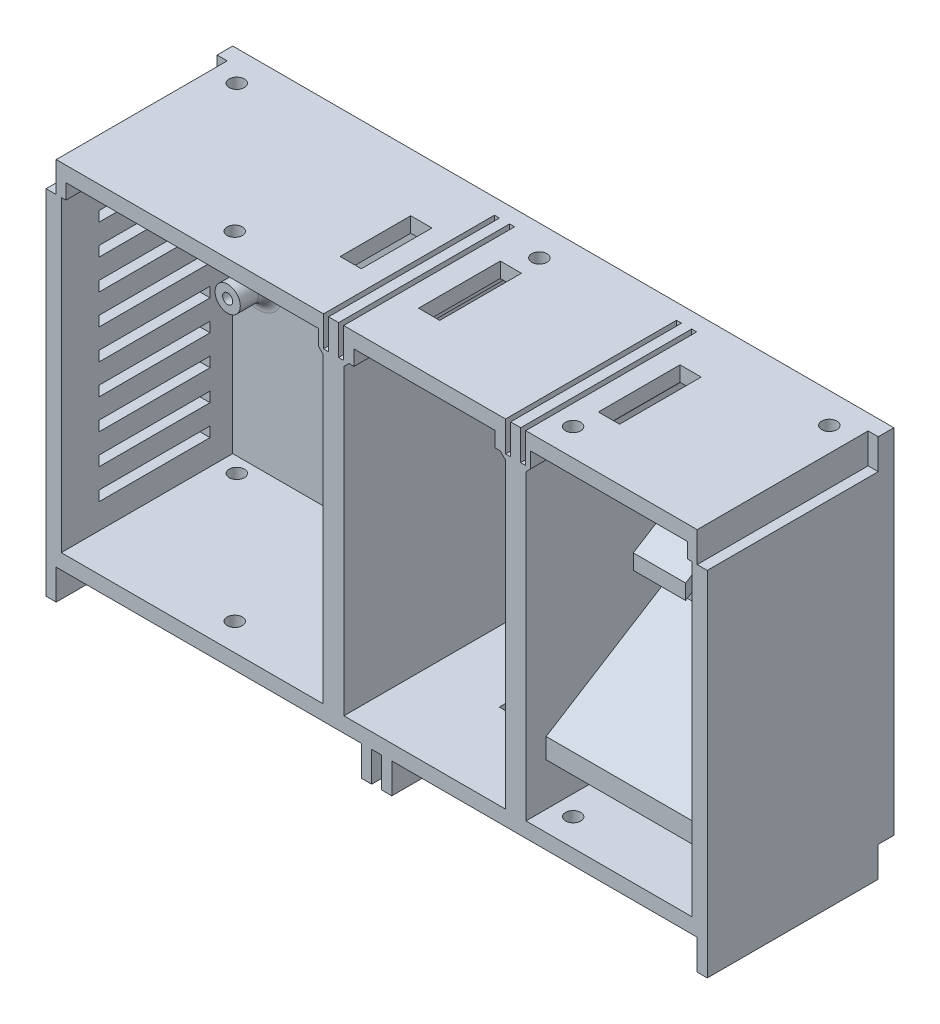
from build123d import *

# Parameters (mm, degrees)
CROQUIS1_W                = 32.1
CROQUIS1_H                = 6
SALIENTE_EXTRUIR1_DEPTH   = 34
CROQUIS1_W_2              = 53
SALIENTE_EXTRUIR1_2_DEPTH = 34
CROQUIS1_W_3              = 34
SALIENTE_EXTRUIR1_3_DEPTH = 34
CROQUIS1_W_4              = 2
SALIENTE_EXTRUIR1_4_DEPTH = 34
SALIENTE_EXTRUIR1_5_DEPTH = 34
SALIENTE_EXTRUIR2_DEPTH   = 3
SALIENTE_EXTRUIR3_DEPTH   = 31
SALIENTE_EXTRUIR4_DEPTH   = 3
SALIENTE_EXTRUIR10_DEPTH  = 31
CORTAR_EXTRUIR1_REACH     = 151.797
CROQUIS6_W                = 4.2
CROQUIS6_H                = 14
CROQUIS6_H_2              = 16.2
CORTAR_EXTRUIR2_START     = -31
CROQUIS7_W                = 25.05
CROQUIS7_H                = 3
CROQUIS7_W_2              = 14
CROQUIS7_W_3              = 15.6
CORTAR_EXTRUIR2_DEPTH     = 31
CORTAR_EXTRUIR8_DEPTH     = 3
CROQUIS24_W               = 4.416361802
CROQUIS24_H               = 6.54510403
CORTAR_EXTRUIR11_DEPTH    = 149.050025329
CROQUIS25_W               = 53
CROQUIS25_H               = 6
CROQUIS25_W_2             = 32.1
CROQUIS25_W_3             = 34
SALIENTE_EXTRUIR15_DEPTH  = 1
CROQUIS26_W               = 10
CROQUIS26_H               = 6
CROQUIS26_R               = 2.5
CROQUIS26_R_2             = 1
SALIENTE_EXTRUIR16_DEPTH  = 6
REDONDEO1_R               = 2.4
CHAFL_N1_SIZE             = 1
CROQUIS10_W               = 22
CROQUIS10_H               = 2
CORTAR_EXTRUIR3_DEPTH     = 3
SALIENTE_EXTRUIR12_DEPTH  = 32.95
SALIENTE_EXTRUIR17_DEPTH  = 32.95
CROQUIS38_W               = 6.1
CROQUIS38_H               = 26
CORTAR_EXTRUIR12_DEPTH    = 16.339354
CORTAR_EXTRUIR13_REACH    = 153.103
CROQUIS40_R               = 1.5
CROQUIS42_W               = 31.075
CROQUIS42_H               = 1
CROQUIS42_W_2             = 30
CROQUIS42_W_3             = 50.896493166
CROQUIS42_H_2             = 1.1
SALIENTE_EXTRUIR18_DEPTH  = 0.2
CROQUIS44_R               = 2.5
CROQUIS44_R_2             = 1.2
SALIENTE_EXTRUIR19_DEPTH  = 3
REDONDEO2_R               = 3
CROQUIS48_W               = 3.1
CROQUIS48_H               = 6
SALIENTE_EXTRUIR20_DEPTH  = 131.1
CROQUIS49_W               = 2
CROQUIS49_H               = 6
SALIENTE_EXTRUIR21_DEPTH  = 33.9
CROQUIS50_R               = 1.5
CORTAR_EXTRUIR14_DEPTH    = 3
CROQUIS51_W               = 0.1
CROQUIS51_H               = 70
CORTAR_EXTRUIR15_DEPTH    = 153.457239907
CROQUIS52_W               = 6
CROQUIS52_H               = 8
CORTAR_EXTRUIR16_DEPTH    = 3
CROQUIS53_W               = 32.95
CROQUIS53_H               = 4
CROQUIS53_H_2             = 2.672226941
CORTAR_EXTRUIR17_DEPTH    = 4
CROQUIS54_W               = 131.1
CROQUIS54_H               = 70
SALIENTE_EXTRUIR22_DEPTH  = 0.1


with BuildPart() as part:
    # Croquis1 → Saliente-Extruir1 (new body)
    with BuildSketch(Plane.XY):
        with Locations((75.05, 3)):
            Rectangle(CROQUIS1_W, CROQUIS1_H)
    extrude(amount=SALIENTE_EXTRUIR1_DEPTH)



with BuildPart() as body_2:
    # Croquis1 → Saliente-Extruir1 2 (new body)
    with BuildSketch(Plane.XY):
        with Locations((28.5, 3)):
            Rectangle(CROQUIS1_W_2, CROQUIS1_H)
    extrude(amount=SALIENTE_EXTRUIR1_2_DEPTH)


with BuildPart() as body_3:
    # Croquis1 → Saliente-Extruir1 3 (new body)
    with BuildSketch(Plane.XY):
        with Locations((112.1, 3)):
            Rectangle(CROQUIS1_W_3, CROQUIS1_H)
    extrude(amount=SALIENTE_EXTRUIR1_3_DEPTH)


with BuildPart() as body_4:
    # Croquis1 → Saliente-Extruir1 4 (new body)
    with BuildSketch(Plane.XY):
        with Locations((93.1, 3)):
            Rectangle(CROQUIS1_W_4, CROQUIS1_H)
    extrude(amount=SALIENTE_EXTRUIR1_4_DEPTH)


with BuildPart() as body_5:
    # Croquis1 → Saliente-Extruir1 5 (new body)
    with BuildSketch(Plane.XY):
        with Locations((57, 3)):
            Rectangle(CROQUIS1_W_4, CROQUIS1_H)
    extrude(amount=SALIENTE_EXTRUIR1_5_DEPTH)


with BuildPart() as part_1:
    add(part.part)

    add(body_2.part)  # Saliente-Extruir2 merges body 2

    add(body_3.part)  # Saliente-Extruir2 merges body 3

    add(body_4.part)  # Saliente-Extruir2 merges body 4

    add(body_5.part)  # Saliente-Extruir2 merges body 5
    # Croquis2 → Saliente-Extruir2 (add)
    with BuildSketch(Plane.XY):
        Polygon((2, -64), (129.1, -64), (131.1, -64), (131.1, 0), (129.1, 0), (2, 0), (0, 0), (0, -64), align=None)
    extrude(amount=SALIENTE_EXTRUIR2_DEPTH)

    # Croquis3 → Saliente-Extruir3 (add)
    with BuildSketch(Plane.XY.offset(3)):
        Polygon((131.1, 0), (128.1, 0), (128.1, -61), (3, -61), (3, 0), (0, 0), (0, -64), (3, -64), (128.1, -64), (131.1, -64), align=None)
    extrude(amount=SALIENTE_EXTRUIR3_DEPTH)

    # Croquis4 → Saliente-Extruir4 (add)
    with BuildSketch(Plane(origin=(0, 0, 0), x_dir=(-1, 0, 0), z_dir=(0, 0, -1))):
        Polygon((-59, 0), (-59, 6), (-91.1, 6), (-91.1, 0), (-92.1, 0), (-92.1, 6), (-94.1, 6), (-94.1, 0), (-95.1, 0), (-95.1, 6), (-129.1, 6), (-129.1, 0), (-131.1, 0), (-131.1, -64), (0, -64), (0, 0), (-2, 0), (-2, 6), (-55, 6), (-55, 0), (-56, 0), (-56, 6), (-58, 6), (-58, 0), align=None)
    extrude(amount=SALIENTE_EXTRUIR4_DEPTH)

    # Croquis5 → Saliente-Extruir10 (add)
    with BuildSketch(Plane.XY.offset(3)):
        Polygon((55, 0), (54.95, 0), (54.95, -61), (59.05, -61), (59.05, 0), (59, 0), (58, 0), (56, 0), align=None)
        Polygon((91.1, 0), (91.05, 0), (91.05, -61), (95.15, -61), (95.15, 0), (95.1, 0), (94.1, 0), (92.1, 0), align=None)
    extrude(amount=SALIENTE_EXTRUIR10_DEPTH)

    # Croquis6 → Cortar-Extruir1 (cut, up to next)
    with BuildSketch(Plane.XZ, mode=Mode.PRIVATE) as cortar_extruir1_sk1:
        with Locations((48.9, 15.5)):
            Rectangle(CROQUIS6_W, CROQUIS6_H)
    cortar_extruir1_tool1 = extrude(cortar_extruir1_sk1.sketch, amount=-CORTAR_EXTRUIR1_REACH, mode=Mode.PRIVATE) & part_1.part
    # Croquis6 → Cortar-Extruir1 (cut, up to next)
    with BuildSketch(Plane.XZ, mode=Mode.PRIVATE) as cortar_extruir1_sk2:
        with Locations((101.2, 15.5)):
            Rectangle(CROQUIS6_W, CROQUIS6_H_2)
    cortar_extruir1_tool2 = extrude(cortar_extruir1_sk2.sketch, amount=-CORTAR_EXTRUIR1_REACH, mode=Mode.PRIVATE) & part_1.part
    # Croquis6 → Cortar-Extruir1 (cut, up to next)
    with BuildSketch(Plane.XZ, mode=Mode.PRIVATE) as cortar_extruir1_sk3:
        with Locations((65.55, 15.5)):
            Rectangle(CROQUIS6_W, CROQUIS6_H_2)
    cortar_extruir1_tool3 = extrude(cortar_extruir1_sk3.sketch, amount=-CORTAR_EXTRUIR1_REACH, mode=Mode.PRIVATE) & part_1.part
    add(cortar_extruir1_tool1.solids().sort_by_distance((48.9, 0, 15.5))[0], mode=Mode.SUBTRACT)
    add(cortar_extruir1_tool2.solids().sort_by_distance((101.2, 0, 15.5))[0], mode=Mode.SUBTRACT)
    add(cortar_extruir1_tool3.solids().sort_by_distance((65.55, 0, 15.5))[0], mode=Mode.SUBTRACT)

    # Croquis7 → Cortar-Extruir2 (cut)
    with BuildSketch(Plane.XY.offset(34).offset(CORTAR_EXTRUIR2_START)):
        with Locations((41.5, 1.5)):
            Rectangle(CROQUIS7_W, CROQUIS7_H)
        with Locations((16.45, 1.5)):
            Rectangle(CROQUIS7_W, CROQUIS7_H)
        with Locations((68.05, 1.5)):
            Rectangle(CROQUIS7_W_2, CROQUIS7_H)
        with Locations((82.05, 1.5)):
            Rectangle(CROQUIS7_W_2, CROQUIS7_H)
        with Locations((103.825, 1.5)):
            Rectangle(CROQUIS7_W_3, CROQUIS7_H)
        with Locations((119.425, 1.5)):
            Rectangle(CROQUIS7_W_3, CROQUIS7_H)
    extrude(amount=CORTAR_EXTRUIR2_DEPTH, mode=Mode.SUBTRACT)

    # Croquis22 → Cortar-Extruir8 (cut)
    with BuildSketch(Plane.XY.offset(3)):
        Polygon((95.15, 0), (95.15, -61), (128.1, -61), (128.1, 0), (127.225, 0), (127.225, 3), (96.025, 3), (96.025, 0), align=None)
        Polygon((91.05, -61), (91.05, 0), (89.05, 0), (89.05, 3), (61.05, 3), (61.05, 0), (59.05, 0), (59.05, -61), align=None)
        Polygon((54.95, -61), (54.95, 0), (54.025, 0), (54.025, 3), (3.925, 3), (3.925, 0), (3, 0), (3, -61), align=None)
    extrude(amount=-CORTAR_EXTRUIR8_DEPTH, mode=Mode.SUBTRACT)

    # Croquis24 → Cortar-Extruir11 (cut, through all)
    with BuildSketch(Plane.ZY.offset(-2)):
        with Locations((-2.108180901, 3.272552015)):
            Rectangle(CROQUIS24_W, CROQUIS24_H)
    extrude(amount=-CORTAR_EXTRUIR11_DEPTH, mode=Mode.SUBTRACT)

    # Croquis25 → Saliente-Extruir15 (add)
    with BuildSketch(Plane(origin=(0, 0, 0.1), x_dir=(-1, 0, 0), z_dir=(0, 0, -1))):
        with Locations((-28.5, 3)):
            Rectangle(CROQUIS25_W, CROQUIS25_H)
        with Locations((-75.05, 3)):
            Rectangle(CROQUIS25_W_2, CROQUIS25_H)
        with Locations((-112.1, 3)):
            Rectangle(CROQUIS25_W_3, CROQUIS25_H)
    extrude(amount=-SALIENTE_EXTRUIR15_DEPTH)

    # Croquis26 → Saliente-Extruir16 (add)
    # profile 1 of 3: a face of its own
    with BuildSketch(Plane.XY):
        with Locations((41.1, -42)):
            Rectangle(CROQUIS26_W, CROQUIS26_H)
    # profile 2 of 3: a face of its own
    with BuildSketch(Plane.XY):
        with Locations((24, -8.1)):
            Circle(CROQUIS26_R)
        with Locations((24, -8.1)):
            Circle(CROQUIS26_R_2, mode=Mode.SUBTRACT)
    # profile 3 of 3: a face of its own
    with BuildSketch(Plane.XY):
        with Locations((8, -28.9)):
            Circle(CROQUIS26_R)
        with Locations((8, -28.9)):
            Circle(CROQUIS26_R_2, mode=Mode.SUBTRACT)
    extrude(amount=SALIENTE_EXTRUIR16_DEPTH)

    # Redondeo1
    redondeo1_edges = [part_1.edges().sort_by_distance(p)[0] for p in [
        (46.1, -42, 0),
        (21.5, -8.1, 0),
        (5.5, -28.9, 0),
    ]]
    fillet(redondeo1_edges, radius=REDONDEO1_R)

    # Chaflán1
    chafl_n1_edges = [part_1.edges().sort_by_distance(p)[0] for p in [
        (54.95, 0, 17.05),
        (95.15, 0, 17.05),
        (91.05, 0, 17.05),
        (59.05, 0, 17.05),
    ]]
    chamfer(chafl_n1_edges, length=CHAFL_N1_SIZE)

    # Croquis10 → Cortar-Extruir3 (cut)
    with BuildSketch(Plane.ZY):
        with Locations((15.5, -55)):
            Rectangle(CROQUIS10_W, CROQUIS10_H)
        with Locations((15.5, -49)):
            Rectangle(CROQUIS10_W, CROQUIS10_H)
        with Locations((15.5, -43)):
            Rectangle(CROQUIS10_W, CROQUIS10_H)
        with Locations((15.5, -37)):
            Rectangle(CROQUIS10_W, CROQUIS10_H)
        with Locations((15.5, -31)):
            Rectangle(CROQUIS10_W, CROQUIS10_H)
        with Locations((15.5, -25)):
            Rectangle(CROQUIS10_W, CROQUIS10_H)
        with Locations((15.5, -19)):
            Rectangle(CROQUIS10_W, CROQUIS10_H)
        with Locations((15.5, -13)):
            Rectangle(CROQUIS10_W, CROQUIS10_H)
        with Locations((15.5, -7)):
            Rectangle(CROQUIS10_W, CROQUIS10_H)
    extrude(amount=-CORTAR_EXTRUIR3_DEPTH, mode=Mode.SUBTRACT)

    # Croquis12 → Saliente-Extruir12 (add)
    with BuildSketch(Plane(origin=(95.15, 0, 0), x_dir=(0, 0, -1), z_dir=(1, 0, 0))):
        Polygon((0, -29.754442035), (-34, -51), (-34, -55), (0, -33.754442035), align=None)
    extrude(amount=SALIENTE_EXTRUIR12_DEPTH)

    # Croquis13 → Saliente-Extruir17 (add)
    with BuildSketch(Plane(origin=(95.15, 0, 0), x_dir=(0, 0, -1), z_dir=(1, 0, 0))):
        Polygon((0, -29.754442035), (0, -20.654442035), (-6.784384769, -24.893796149), (-6.784384769, -33.993796149), align=None)
        Polygon((-6.784384769, -24.893796149), (0, -20.654442035), (0, -17.654442035), (-12.720721442, -25.603230999), (-12.720721442, -28.603230999), align=None)
    extrude(amount=SALIENTE_EXTRUIR17_DEPTH)

    # Croquis38 → Cortar-Extruir12 (cut)
    with BuildSketch(Plane(origin=(0, -17.654442035, 0), x_dir=(-1, 0, 0), z_dir=(0, -1, 0))):
        with Locations((-114.675, -13)):
            Rectangle(CROQUIS38_W, CROQUIS38_H)
        with Locations((-108.575, -13)):
            Rectangle(CROQUIS38_W, CROQUIS38_H)
    extrude(amount=CORTAR_EXTRUIR12_DEPTH, mode=Mode.SUBTRACT)

    # Croquis40 → Cortar-Extruir13 (cut, up to next)
    with BuildSketch(Plane.XZ.offset(-3), mode=Mode.PRIVATE) as cortar_extruir13_sk1:
        with Locations(Location((32, 28.6, 0), (0, 0, 270))):
            Circle(CROQUIS40_R)
    cortar_extruir13_tool1 = extrude(cortar_extruir13_sk1.sketch, amount=-CORTAR_EXTRUIR13_REACH, mode=Mode.PRIVATE) & part_1.part
    # Croquis40 → Cortar-Extruir13 (cut, up to next)
    with BuildSketch(Plane.XZ.offset(-3), mode=Mode.PRIVATE) as cortar_extruir13_sk2:
        with Locations(Location((99.1, 28.6, 0), (0, 0, 270))):
            Circle(CROQUIS40_R)
    cortar_extruir13_tool2 = extrude(cortar_extruir13_sk2.sketch, amount=-CORTAR_EXTRUIR13_REACH, mode=Mode.PRIVATE) & part_1.part
    # Croquis40 → Cortar-Extruir13 (cut, up to next)
    with BuildSketch(Plane.XZ.offset(-3), mode=Mode.PRIVATE) as cortar_extruir13_sk3:
        with Locations(Location((6.8, 3, 0), (0, 0, 270))):
            Circle(CROQUIS40_R)
    cortar_extruir13_tool3 = extrude(cortar_extruir13_sk3.sketch, amount=-CORTAR_EXTRUIR13_REACH, mode=Mode.PRIVATE) & part_1.part
    # Croquis40 → Cortar-Extruir13 (cut, up to next)
    with BuildSketch(Plane.XZ.offset(-3), mode=Mode.PRIVATE) as cortar_extruir13_sk4:
        with Locations(Location((124.3, 3, 0), (0, 0, 270))):
            Circle(CROQUIS40_R)
    cortar_extruir13_tool4 = extrude(cortar_extruir13_sk4.sketch, amount=-CORTAR_EXTRUIR13_REACH, mode=Mode.PRIVATE) & part_1.part
    # Croquis40 → Cortar-Extruir13 (cut, up to next)
    with BuildSketch(Plane.XZ.offset(-3), mode=Mode.PRIVATE) as cortar_extruir13_sk5:
        with Locations(Location((66.8, 3, 0), (0, 0, 270))):
            Circle(CROQUIS40_R)
    cortar_extruir13_tool5 = extrude(cortar_extruir13_sk5.sketch, amount=-CORTAR_EXTRUIR13_REACH, mode=Mode.PRIVATE) & part_1.part
    add(cortar_extruir13_tool1.solids().sort_by_distance((32, 3, 28.6))[0], mode=Mode.SUBTRACT)
    add(cortar_extruir13_tool2.solids().sort_by_distance((99.1, 3, 28.6))[0], mode=Mode.SUBTRACT)
    add(cortar_extruir13_tool3.solids().sort_by_distance((6.8, 3, 3))[0], mode=Mode.SUBTRACT)
    add(cortar_extruir13_tool4.solids().sort_by_distance((124.3, 3, 3))[0], mode=Mode.SUBTRACT)
    add(cortar_extruir13_tool5.solids().sort_by_distance((66.8, 3, 3))[0], mode=Mode.SUBTRACT)

    # Croquis42 → Saliente-Extruir18 (add)
    with BuildSketch(Plane.XZ):
        with Locations((111.6875, 0.6)):
            Rectangle(CROQUIS42_W, CROQUIS42_H)
        with Locations((75.05, 0.6)):
            Rectangle(CROQUIS42_W_2, CROQUIS42_H)
        with Locations((28.448246583, 0.55)):
            Rectangle(CROQUIS42_W_3, CROQUIS42_H_2)
    extrude(amount=SALIENTE_EXTRUIR18_DEPTH)

    # Croquis44 → Saliente-Extruir19 (add)
    # profile 1 of 4: a face of its own
    with BuildSketch(Plane.XY):
        with Locations((65.65, -53.7)):
            Circle(CROQUIS44_R)
        with Locations((65.65, -53.7)):
            Circle(CROQUIS44_R_2, mode=Mode.SUBTRACT)
    # profile 2 of 4: a face of its own
    with BuildSketch(Plane.XY):
        with Locations((84.25, -53.7)):
            Circle(CROQUIS44_R)
        with Locations((84.25, -53.7)):
            Circle(CROQUIS44_R_2, mode=Mode.SUBTRACT)
    # profile 3 of 4: a face of its own
    with BuildSketch(Plane.XY):
        with Locations((84.75, -24.2)):
            Circle(CROQUIS44_R)
        with Locations((84.75, -24.2)):
            Circle(CROQUIS44_R_2, mode=Mode.SUBTRACT)
    # profile 4 of 4: a face of its own
    with BuildSketch(Plane.XY):
        with Locations((65.35, -24.2)):
            Circle(CROQUIS44_R)
        with Locations((65.35, -24.2)):
            Circle(CROQUIS44_R_2, mode=Mode.SUBTRACT)
    extrude(amount=SALIENTE_EXTRUIR19_DEPTH)

    # Redondeo2
    redondeo2_edges = [part_1.edges().sort_by_distance(p)[0] for p in [
        (81.75, -53.7, 0),
        (63.15, -53.7, 0),
        (62.85, -24.2, 0),
        (82.25, -24.2, 0),
    ]]
    fillet(redondeo2_edges, radius=REDONDEO2_R - 0.0001)  # a hair under: the kernel refuses the full size

    # Croquis48 → Saliente-Extruir20 (add)
    with BuildSketch(Plane.ZY):
        with Locations((-1.45, 3)):
            Rectangle(CROQUIS48_W, CROQUIS48_H)
    extrude(amount=-SALIENTE_EXTRUIR20_DEPTH)

    # Croquis49 → Saliente-Extruir21 (add)
    with BuildSketch(Plane.XY.offset(34)):
        with Locations((1, -67)):
            Rectangle(CROQUIS49_W, CROQUIS49_H)
        with Locations((63.55, -67)):
            Rectangle(CROQUIS49_W, CROQUIS49_H)
        with Locations((67.55, -67)):
            Rectangle(CROQUIS49_W, CROQUIS49_H)
        with Locations((130.1, -67)):
            Rectangle(CROQUIS49_W, CROQUIS49_H)
    extrude(amount=-SALIENTE_EXTRUIR21_DEPTH)

    # Croquis50 → Cortar-Extruir14 (cut)
    with BuildSketch(Plane.XZ.offset(64)):
        with Locations(Location((124.3, 3, 0), (0, 0, 270))):
            Circle(CROQUIS50_R)
        with Locations(Location((99.1, 28.6, 0), (0, 0, 270))):
            Circle(CROQUIS50_R)
        with Locations(Location((6.8, 3, 0), (0, 0, 270))):
            Circle(CROQUIS50_R)
        with Locations(Location((32, 28.6, 0), (0, 0, 270))):
            Circle(CROQUIS50_R)
    extrude(amount=-CORTAR_EXTRUIR14_DEPTH, mode=Mode.SUBTRACT)

    # Croquis51 → Cortar-Extruir15 (cut, through all)
    with BuildSketch(Plane.ZY):
        with Locations((-2.95, -29)):
            Rectangle(CROQUIS51_W, CROQUIS51_H)
    extrude(amount=-CORTAR_EXTRUIR15_DEPTH, mode=Mode.SUBTRACT)

    # Croquis52 → Cortar-Extruir16 (cut)
    with BuildSketch(Plane.XZ.offset(64)):
        with Locations((75.95, 13.1)):
            Rectangle(CROQUIS52_W, CROQUIS52_H)
    extrude(amount=-CORTAR_EXTRUIR16_DEPTH, mode=Mode.SUBTRACT)

    # Croquis53 → Cortar-Extruir17 (cut)
    with BuildSketch(Plane.XY.offset(34)):
        with Locations((111.625, -53)):
            Rectangle(CROQUIS53_W, CROQUIS53_H)
        with Locations((111.625, -49.66388653)):
            Rectangle(CROQUIS53_W, CROQUIS53_H_2)
    extrude(amount=-CORTAR_EXTRUIR17_DEPTH, mode=Mode.SUBTRACT)

    # Croquis54 → Saliente-Extruir22 (add)
    with BuildSketch(Plane(origin=(0, 0, -2.9), x_dir=(-1, 0, 0), z_dir=(0, 0, -1))):
        with Locations((-65.55, -29)):
            Rectangle(CROQUIS54_W, CROQUIS54_H)
    extrude(amount=SALIENTE_EXTRUIR22_DEPTH)


solid = part_1.part
